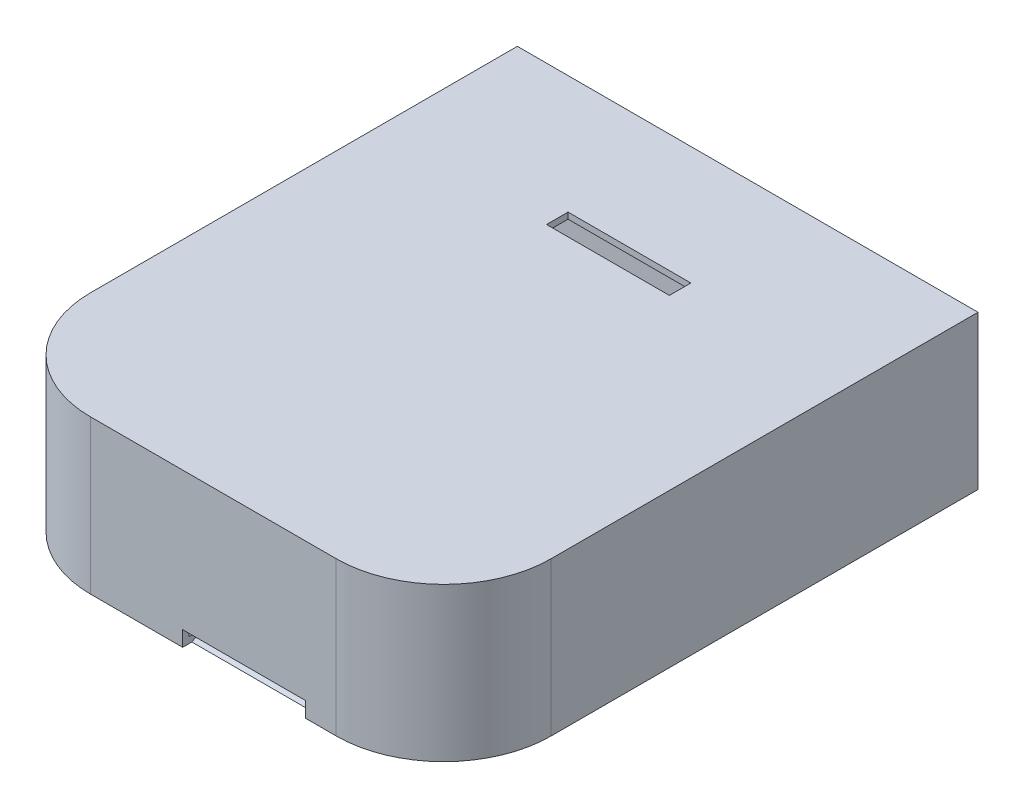
from build123d import *

# Parameters (mm, degrees)
SKETCH1_W           = 1500
SKETCH1_H           = 500
BOSS_EXTRUDE1_DEPTH = 320
SHELL1_T            = 20
SKETCH3_W           = 400
SKETCH3_H           = 70
CUT_EXTRUDE2_DEPTH  = 30
SKETCH4_W           = 1460
SKETCH4_H           = 460
CUT_EXTRUDE3_DEPTH  = 30
BOSS_EXTRUDE2_DEPTH = 500
SHELL2_START        = -230
SHELL2_DEPTH        = 460
SKETCH6_W           = 400
SKETCH6_H           = 50
CUT_EXTRUDE4_DEPTH  = 30
CHAMFER1_SIZE2      = 34.641016151
CHAMFER1_SIZE       = 20


# Read off the part's stored shape, not the designer's step: Shell2
with BuildPart() as part:
    # Sketch1 → Boss-Extrude1 (new, symmetric)
    with BuildSketch(Plane.XY):
        Rectangle(SKETCH1_W, SKETCH1_H)
    extrude(amount=BOSS_EXTRUDE1_DEPTH, both=True)

    # Shell1 (no face opened: a closed hollow body)
    add(offset(amount=-SHELL1_T, mode=Mode.PRIVATE), mode=Mode.SUBTRACT)

    # Sketch3 → Cut-Extrude2 (cut)
    with BuildSketch(Plane(origin=(0, 250, 0), x_dir=(1, 0, 0), z_dir=(0, 1, 0))):
        with Locations((0, -100)):
            Rectangle(SKETCH3_W, SKETCH3_H)
    extrude(amount=-CUT_EXTRUDE2_DEPTH, mode=Mode.SUBTRACT)

    # Sketch4 → Cut-Extrude3 (cut)
    with BuildSketch(Plane.XY.offset(320)):
        Rectangle(SKETCH4_W, SKETCH4_H)
    extrude(amount=-CUT_EXTRUDE3_DEPTH, mode=Mode.SUBTRACT)

    # Sketch5 → Boss-Extrude2 (add)
    with BuildSketch(Plane(origin=(0, 250, 0), x_dir=(1, 0, 0), z_dir=(0, 1, 0))):
        with BuildLine():
            Line((-750, -320), (750, -320))
            Line((750, -320), (750, -1070))
            ThreePointArc((750, -1070), (647.487373415, -1317.487373415), (400, -1420))
            Line((400, -1420), (-400, -1420))
            ThreePointArc((-400, -1420), (-647.487373415, -1317.487373415), (-750, -1070))
            Line((-750, -1070), (-750, -320))
        make_face()
    extrude(amount=-BOSS_EXTRUDE2_DEPTH)

    # Shell2 outline → Shell2 (cut)
    with BuildSketch(Plane(origin=(0, 0, 0), x_dir=(1, 0, 0), z_dir=(0, 1, 0)).offset(SHELL2_START)):
        with BuildLine():
            Line((730, -1070), (730, -340))
            Line((730, -340), (-730, -340))
            Line((-730, -340), (-730, -1070))
            ThreePointArc((-730, -1070), (-633.345237792, -1303.345237792), (-400, -1400))
            Line((-400, -1400), (400, -1400))
            ThreePointArc((400, -1400), (633.345237792, -1303.345237792), (730, -1070))
        make_face()
    extrude(amount=SHELL2_DEPTH, mode=Mode.SUBTRACT)

    # Sketch6 → Cut-Extrude4 (cut)
    with BuildSketch(Plane.XY.offset(1420)):
        with Locations((100, -225)):
            Rectangle(SKETCH6_W, SKETCH6_H)
    extrude(amount=-CUT_EXTRUDE4_DEPTH, mode=Mode.SUBTRACT)

    # Chamfer1
    chamfer1_edges = [part.edges().sort_by_distance(p)[0] for p in [
        (100, -230, 1390),
    ]]
    chamfer1_side = [part.faces().sort_by_distance(p)[0] for p in [
        (100, -230.4, 1390),
    ]]
    chamfer(chamfer1_edges, length=CHAMFER1_SIZE - 0.0001, length2=CHAMFER1_SIZE2 - 0.0001, reference=chamfer1_side[0])  # a hair under: the kernel refuses the full size


solid = part.part
